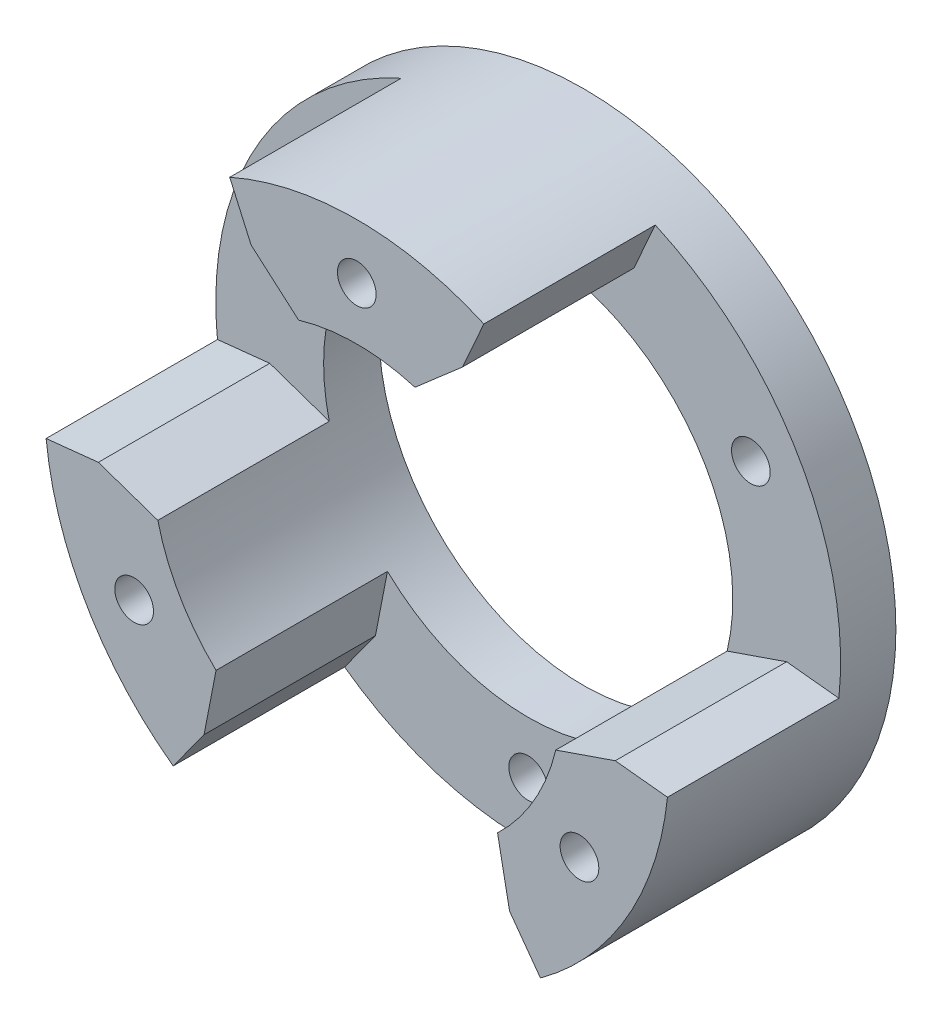
from build123d import *

# Parameters (mm, degrees)
BOSS_EXTRUDE1_DEPTH = 15.5
CHAMFER1_START      = 3
CHAMFER1_DEPTH      = 16
CIRPATTERN1_COUNT   = 3
SKETCH4_R           = 1.75
CUT_EXTRUDE1_DEPTH  = 12
CIRPATTERN2_COUNT   = 3
SKETCH5_R           = 1.75
CUT_EXTRUDE2_DEPTH  = 43.852946223
CIRPATTERN3_COUNT   = 3


with BuildPart() as part:
    # Sketch2 → Revolve1 (revolve)
    with BuildSketch(Plane(origin=(0, 0, 0), x_dir=(0, 0, -1), z_dir=(1, 0, 0)), mode=Mode.PRIVATE) as revolve1_sk:
        Polygon((0, 28.25), (-3, 28.25), (-3, 18.5), (0, 18.5), (2, 18.5), (2, 28.25), align=None)
    revolve(revolve1_sk.sketch.rotate(Axis((0, 0, 0), (0, 0, 1)), 90), axis=Axis((0, 0, 0), (0, 0, 1)))

    # Sketch3 → Boss-Extrude1 (add)
    with BuildSketch(Plane.XY.offset(3)):
        with BuildLine():
            Line((-7.524627897, 16.900590966), (-11.490310167, 25.807659178))
            ThreePointArc((-11.490310167, 25.807659178), (0, 28.25), (11.490310167, 25.807659178))
            Line((11.490310167, 25.807659178), (7.524627897, 16.900590966))
            ThreePointArc((7.524627897, 16.900590966), (0, 18.5), (-7.524627897, 16.900590966))
        make_face()
    boss_extrude1 = extrude(amount=BOSS_EXTRUDE1_DEPTH)

    # Chamfer1: read off the stored shape, not the designer's step
    # Chamfer1 outline → Chamfer1 (cut)
    with BuildSketch(Plane.XY.offset(CHAMFER1_START)):
        with BuildLine():
            Line((7.524627897, 16.900590966), (9.558311113, 21.468318255))
            Line((9.558311113, 21.468318255), (5.263960206, 17.735295964))
            ThreePointArc((5.263960206, 17.735295964), (6.407899775, 17.354792435), (7.524627897, 16.900590966))
        make_face()
        with BuildLine():
            ThreePointArc((-7.524627897, 16.900590966), (-6.407899775, 17.354792435), (-5.263960206, 17.735295964))
            Line((-5.263960206, 17.735295964), (-9.558311112, 21.468318255))
            Line((-9.558311112, 21.468318255), (-7.524627897, 16.900590966))
        make_face()
    chamfer1 = extrude(amount=CHAMFER1_DEPTH, mode=Mode.SUBTRACT)

    # CirPattern1: Boss-Extrude1, Chamfer1 ×3 about axis
    cirpattern1_axis = Axis((0, 0, 0), (0, 0, 1))
    add([boss_extrude1.rotate(cirpattern1_axis, i * 360 / CIRPATTERN1_COUNT) for i in range(1, CIRPATTERN1_COUNT)])
    add([chamfer1.rotate(cirpattern1_axis, i * 360 / CIRPATTERN1_COUNT) for i in range(1, CIRPATTERN1_COUNT)], mode=Mode.SUBTRACT)

    # Sketch4 → Cut-Extrude1 (cut)
    with BuildSketch(Plane.XY.offset(18.5)):
        with Locations((0, 23.25)):
            Circle(SKETCH4_R)
    cut_extrude1 = extrude(amount=-CUT_EXTRUDE1_DEPTH, mode=Mode.SUBTRACT)

    # CirPattern2: Cut-Extrude1 ×3 about axis
    cirpattern2_axis = Axis((0, 0, 0), (0, 0, 1))
    for i in range(1, CIRPATTERN2_COUNT):
        add(cut_extrude1.rotate(cirpattern2_axis, i * 360 / CIRPATTERN2_COUNT), mode=Mode.SUBTRACT)

    # Sketch5 → Cut-Extrude2 (cut, through all)
    with BuildSketch(Plane.XY.offset(3)):
        with Locations((0, -23.25)):
            Circle(SKETCH5_R)
    cut_extrude2 = extrude(amount=-CUT_EXTRUDE2_DEPTH, mode=Mode.SUBTRACT)

    # CirPattern3: Cut-Extrude2 ×3 about axis
    cirpattern3_axis = Axis((0, 0, 0), (0, 0, 1))
    for i in range(1, CIRPATTERN3_COUNT):
        add(cut_extrude2.rotate(cirpattern3_axis, i * 360 / CIRPATTERN3_COUNT), mode=Mode.SUBTRACT)


solid = part.part
